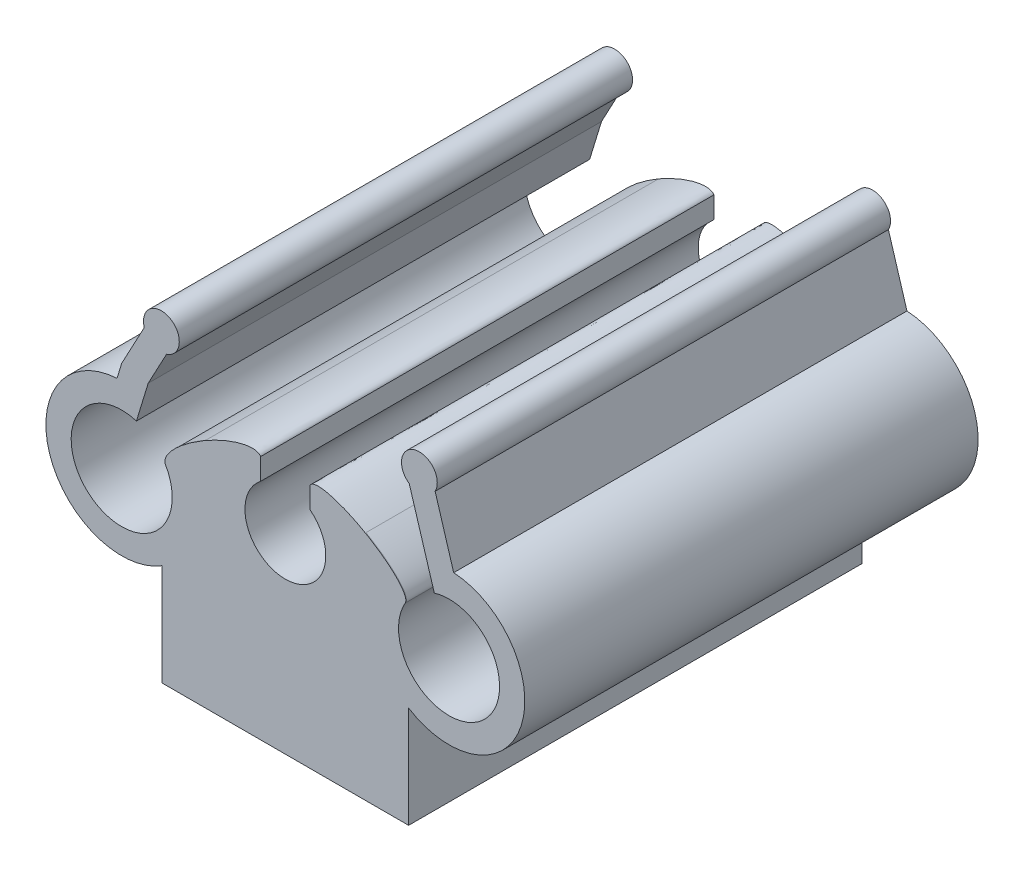
from build123d import *

# Parameters (mm, degrees)
Y_KSEKLIK_EKSTR_ZYON1_DEPTH = 22.43
Y_KSEKLIK_EKSTR_ZYON3_DEPTH = 22.4
KES_EKSTR_ZYON3_DEPTH       = 22.5
IZIM5_W                     = 2.45
IZIM5_H                     = 2.066636174
KES_EKSTR_ZYON4_DEPTH       = 22.5
IZIM6_W                     = 15.451787419
IZIM6_H                     = 18.225757046
KES_EKSTR_ZYON5_DEPTH       = 22.5
Y_KSEKLIK_EKSTR_ZYON5_DEPTH = 0.03
KES_EKSTR_ZYON7_DEPTH       = 25
KES_EKSTR_ZYON8_DEPTH       = 25
KES_EKSTR_ZYON9_DEPTH       = 25
KES_EKSTR_ZYON10_DEPTH      = 25
Y_KSEKLIK_EKSTR_ZYON7_START = -22.43
IZIM15_R                    = 0.885
Y_KSEKLIK_EKSTR_ZYON7_DEPTH = 22.43
KES_EKSTR_ZYON12_START      = -25
KES_EKSTR_ZYON12_DEPTH      = 25


with BuildPart() as part:
    # Çizim1 → Yükseklik-Ekstrüzyon1 (new body)
    with BuildSketch(Plane.XY):
        with BuildLine():
            Line((0, 4.168871126), (0, 0))
            Line((0, 0), (12.2, 0))
            Line((12.2, 0), (12.2, 4.168871126))
            ThreePointArc((12.2, 4.168871126), (18.58121444, 7.172887527), (14.2, 12.7))
            Line((14.2, 12.7), (13.080916647, 14.793032346))
            ThreePointArc((13.080916647, 14.793032346), (11.817033945, 15.831345203), (11.978588262, 14.203649507))
            Line((11.978588262, 14.203649507), (12.887207184, 12.504250808))
            Line((12.887207184, 12.504250808), (13.470670658, 10.591250449))
            ThreePointArc((13.470670658, 10.591250449), (15.758549535, 6.245281773), (12.031216834, 9.443535113))
            Line((12.031216834, 9.443535113), (10.2961903, 10.438363203))
            Line((10.2961903, 10.438363203), (7.999890113, 11.755013921))
            Line((7.999890113, 11.755013921), (7.086391214, 12.27879517))
            Line((7.086391214, 12.27879517), (7.086391214, 11.239836881))
            ThreePointArc((7.086391214, 11.239836881), (7.828117824, 10.506781399), (8.1, 9.5))
            ThreePointArc((8.1, 9.5), (5.093218601, 7.771882176), (5.113608786, 11.239836881))
            Line((5.113608786, 11.239836881), (5.113608786, 12.27879517))
            Line((5.113608786, 12.27879517), (4.200109887, 11.755013921))
            Line((4.200109887, 11.755013921), (1.9038097, 10.438363203))
            Line((1.9038097, 10.438363203), (0.168783166, 9.443535113))
            ThreePointArc((0.168783166, 9.443535113), (-3.544803783, 6.234400531), (-1.304278774, 10.601243839))
            Line((-1.304278774, 10.601243839), (-0.747701793, 12.522238911))
            Line((-0.747701793, 12.522238911), (-0.115093584, 14.608601518))
            ThreePointArc((-0.115093584, 14.608601518), (-0.274595552, 16.23649961), (-1.311314062, 14.971308793))
            Line((-1.311314062, 14.971308793), (-2, 12.7))
            ThreePointArc((-2, 12.7), (-6.38121444, 7.172887527), (0, 4.168871126))
        make_face()
    y_kseklik_ekstr_zyon1 = extrude(amount=Y_KSEKLIK_EKSTR_ZYON1_DEPTH)

    # Çizim2 → Yükseklik-Ekstrüzyon3 (add)
    with BuildSketch(Plane(origin=(0, 0, 0), x_dir=(-1, 0, 0), z_dir=(0, 0, -1))):
        with BuildLine():
            Line((-12.031216834, 9.443535113), (-7.086391214, 12.27879517))
            add(Edge.make_bspline(
                [(-7.086391214, 12.27879517), (-7.47040591, 12.948534689), (-9.94281872, 11.53090466), (-12.41523153, 10.113274632), (-12.031216834, 9.443535113)],
                knots=[3.141592654, 3.141592654, 3.141592654, 4.71238898, 4.71238898, 6.283185307, 6.283185307, 6.283185307], degree=2, weights=[1, 0.707106781, 1, 0.707106781, 1]))
        make_face()
        with BuildLine():
            Line((-5.113608786, 12.27879517), (-0.168783166, 9.443535113))
            add(Edge.make_bspline(
                [(-0.168783166, 9.443535113), (0.214205175, 10.111484622), (-2.258207635, 11.529114651), (-4.730620444, 12.946744679), (-5.113608786, 12.27879517)],
                knots=[0, 0, 0, 1.570796327, 1.570796327, 3.141592654, 3.141592654, 3.141592654], degree=2, weights=[1, 0.707106781, 1, 0.707106781, 1]))
        make_face()
    y_kseklik_ekstr_zyon3 = extrude(amount=-Y_KSEKLIK_EKSTR_ZYON3_DEPTH)

    # Çizim3 → Kes-Ekstrüzyon3 (cut)
    with BuildSketch(Plane(origin=(0, 0, 0), x_dir=(-1, 0, 0), z_dir=(0, 0, -1))):
        with BuildLine():
            Line((2, 12.7), (3.124833416, 11.575166584))
            ThreePointArc((3.124833416, 11.575166584), (5.188887828, 6.622662336), (0, 5.257722025))
            Line((0, 5.257722025), (0, 4.168871126))
            ThreePointArc((0, 4.168871126), (6.38121444, 7.172887527), (2, 12.7))
        make_face()
        with BuildLine():
            Line((-12.2, 5.257722025), (-12.2, 4.168871126))
            ThreePointArc((-12.2, 4.168871126), (-18.58121444, 7.172887527), (-14.2, 12.7))
            Line((-14.2, 12.7), (-15.324833416, 11.575166584))
            ThreePointArc((-15.324833416, 11.575166584), (-17.388887828, 6.622662336), (-12.2, 5.257722025))
        make_face()
    extrude(amount=-KES_EKSTR_ZYON3_DEPTH, mode=Mode.SUBTRACT)

    # Çizim5 → Kes-Ekstrüzyon4 (cut)
    with BuildSketch(Plane(origin=(0, 0, 0), x_dir=(-1, 0, 0), z_dir=(0, 0, -1))):
        with Locations((-6.1, 12.114259262)):
            Rectangle(IZIM5_W, IZIM5_H)
    kes_ekstr_zyon4 = extrude(amount=-KES_EKSTR_ZYON4_DEPTH, mode=Mode.SUBTRACT)

    # Çizim6 → Kes-Ekstrüzyon5 (cut)
    with BuildSketch(Plane(origin=(0, 0, 0), x_dir=(-1, 0, 0), z_dir=(0, 0, -1))):
        with Locations((1.62589371, 9.112878523)):
            Rectangle(IZIM6_W, IZIM6_H)
    extrude(amount=-KES_EKSTR_ZYON5_DEPTH, mode=Mode.SUBTRACT)

    # Çizim9 → Yükseklik-Ekstrüzyon5 (add)
    with BuildSketch(Plane.XY.offset(22.4)):
        with BuildLine():
            Line((7.325, 12.14198186), (12.031216834, 9.443535113))
            add(Edge.make_bspline(
                [(12.031216834, 9.443535113), (12.414784185, 10.112494443), (10.061675769, 11.461717816), (7.708567352, 12.81094119), (7.325, 12.14198186)],
                knots=[0, 0, 0, 1.570796327, 1.570796327, 3.141592654, 3.141592654, 3.141592654], degree=2, weights=[1, 0.707106781, 1, 0.707106781, 1]))
        make_face()
    y_kseklik_ekstr_zyon5 = extrude(amount=Y_KSEKLIK_EKSTR_ZYON5_DEPTH)

    # Çizim10 → Kes-Ekstrüzyon7 (cut)
    with BuildSketch(Plane.XY.offset(22.4)):
        with BuildLine():
            add(Edge.make_bspline(
                [(10.061675769, 11.461717816), (8.187064538, 12.56942491), (7.325, 12.416183553)],
                knots=[4.664115998, 4.664115998, 4.664115998, 5.969971614, 5.969971614, 5.969971614], degree=2, weights=[1, 0.794308519, 1]))
            Line((7.325, 12.416183553), (7.325, 12.14198186))
            add(Edge.make_bspline(
                [(10.061675769, 11.461717816), (7.708567352, 12.81094119), (7.325, 12.14198186)],
                knots=[1.570796327, 1.570796327, 1.570796327, 3.141592654, 3.141592654, 3.141592654], degree=2, weights=[1, 0.707106781, 1]))
        make_face()
    extrude(amount=-KES_EKSTR_ZYON7_DEPTH, mode=Mode.SUBTRACT)

    # Aynalama3: Yükseklik-Ekstrüzyon1, Yükseklik-Ekstrüzyon3, Kes-Ekstrüzyon4, Yükseklik-Ekstrüzyon5 across plane
    add(y_kseklik_ekstr_zyon1.mirror(Plane(origin=(6.1, 0, 22.5), x_dir=(0, 0, 1), z_dir=(1, 0, 0))))
    add(y_kseklik_ekstr_zyon3.mirror(Plane(origin=(6.1, 0, 22.5), x_dir=(0, 0, 1), z_dir=(1, 0, 0))))
    add(kes_ekstr_zyon4.mirror(Plane(origin=(6.1, 0, 22.5), x_dir=(0, 0, 1), z_dir=(1, 0, 0))), mode=Mode.SUBTRACT)
    add(y_kseklik_ekstr_zyon5.mirror(Plane(origin=(6.1, 0, 22.5), x_dir=(0, 0, 1), z_dir=(1, 0, 0))))

    # Çizim11 → Kes-Ekstrüzyon8 (cut)
    with BuildSketch(Plane(origin=(0, 0, 0), x_dir=(-1, 0, 0), z_dir=(0, 0, -1))):
        with BuildLine():
            Line((-14.2, 12.7), (-14.429540401, 11.942968234))
            ThreePointArc((-14.429540401, 11.942968234), (-17.769079354, 7.049273027), (-12.2, 5.027855615))
            Line((-12.2, 5.027855615), (-12.2, 4.168871126))
            ThreePointArc((-12.2, 4.168871126), (-18.58121444, 7.172887527), (-14.2, 12.7))
        make_face()
        with BuildLine():
            Line((0, 4.168871126), (0, 5.027855615))
            ThreePointArc((0, 5.027855615), (5.569079354, 7.049273027), (2.229540401, 11.942968234))
            Line((2.229540401, 11.942968234), (2, 12.7))
            ThreePointArc((2, 12.7), (6.38121444, 7.172887527), (0, 4.168871126))
        make_face()
    extrude(amount=-KES_EKSTR_ZYON8_DEPTH, mode=Mode.SUBTRACT)

    # Çizim13 → Kes-Ekstrüzyon9 (cut)
    with BuildSketch(Plane.XY.offset(22.4)):
        with BuildLine():
            add(Edge.make_bspline(
                [(4.875, 12.14198186), (4.491432648, 12.81094119), (2.138324231, 11.461717816)],
                knots=[3.141592654, 3.141592654, 3.141592654, 4.71238898, 4.71238898, 4.71238898], degree=2, weights=[1, 0.707106781, 1]))
            Line((4.875, 12.14198186), (4.875, 12.416183553))
            add(Edge.make_bspline(
                [(4.875, 12.416183553), (4.012935462, 12.56942491), (2.138324231, 11.461717816)],
                knots=[0.313213693, 0.313213693, 0.313213693, 1.61906931, 1.61906931, 1.61906931], degree=2, weights=[1, 0.794308519, 1]))
        make_face()
        with BuildLine():
            Line((7.325, 12.416183553), (7.325, 12.14198186))
            add(Edge.make_bspline(
                [(10.061675769, 11.461717816), (7.708567352, 12.81094119), (7.325, 12.14198186)],
                knots=[1.570796327, 1.570796327, 1.570796327, 3.141592654, 3.141592654, 3.141592654], degree=2, weights=[1, 0.707106781, 1]))
            add(Edge.make_bspline(
                [(10.061675769, 11.461717816), (8.187064538, 12.56942491), (7.325, 12.416183553)],
                knots=[1.522523344, 1.522523344, 1.522523344, 2.828378961, 2.828378961, 2.828378961], degree=2, weights=[1, 0.794308519, 1]))
        make_face()
    extrude(amount=-KES_EKSTR_ZYON9_DEPTH, mode=Mode.SUBTRACT)

    # Çizim14 → Kes-Ekstrüzyon10 (cut)
    with BuildSketch(Plane.XY.offset(22.43)):
        Polygon((13.470670658, 10.591250449), (11.804417735, 16.054390099), (10.234064856, 15.575433813), (11.754236521, 10.591250449), align=None)
    extrude(amount=-KES_EKSTR_ZYON10_DEPTH, mode=Mode.SUBTRACT)

    # Çizim15 → Yükseklik-Ekstrüzyon7 (add)
    with BuildSketch(Plane.XY.offset(22.43).offset(Y_KSEKLIK_EKSTR_ZYON7_START)):
        with Locations((12.731392302, 15.389575511)):
            Circle(IZIM15_R)
    extrude(amount=Y_KSEKLIK_EKSTR_ZYON7_DEPTH)

    # Çizim16 → Kes-Ekstrüzyon12 (cut)
    with BuildSketch(Plane.XY.offset(22.43).offset(KES_EKSTR_ZYON12_START)):
        with BuildLine():
            Line((11.865161878, 15.855228416), (11.9081336, 15.714337131))
            ThreePointArc((11.9081336, 15.714337131), (11.955095653, 15.814532583), (12.014193955, 15.908084461))
            Line((12.014193955, 15.908084461), (11.972922672, 15.949355745))
            Line((11.972922672, 15.949355745), (11.862150279, 15.865775874))
            Line((11.862150279, 15.865775874), (11.865161878, 15.855228416))
        make_face()
    extrude(amount=KES_EKSTR_ZYON12_DEPTH, mode=Mode.SUBTRACT)


solid = part.part
